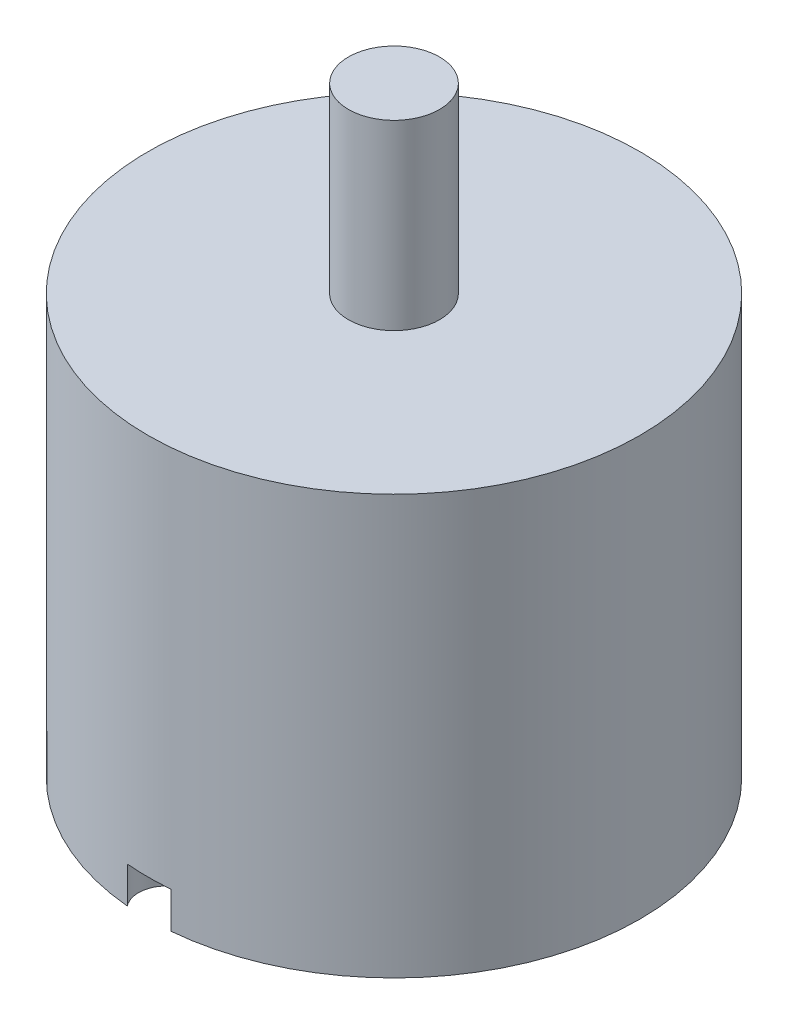
from build123d import *

# Parameters (mm, degrees)
SKETCH1_R           = 13.499973
BOSS_EXTRUDE1_DEPTH = 23.0000048
SKETCH2_R           = 2.5
BOSS_EXTRUDE2_DEPTH = 10
SKETCH3_R           = 1.626997
BOSS_EXTRUDE3_DEPTH = 2
SKETCH4_R           = 1.524
SKETCH4_R_2         = 1.5
CUT_EXTRUDE1_DEPTH  = 2


with BuildPart() as part:
    # Sketch1 → Boss-Extrude1 (new body)
    with BuildSketch(Plane(origin=(0, 0, 0), x_dir=(1, 0, 0), z_dir=(0, 1, 0))):
        Circle(SKETCH1_R)
    extrude(amount=BOSS_EXTRUDE1_DEPTH)

    # Sketch2 → Boss-Extrude2 (add)
    with BuildSketch(Plane(origin=(0, 23.0000048, 0), x_dir=(1, 0, 0), z_dir=(0, 1, 0))):
        Circle(SKETCH2_R)
    extrude(amount=BOSS_EXTRUDE2_DEPTH)

    # Sketch3 → Boss-Extrude3 (add)
    with BuildSketch(Plane.XZ):
        Circle(SKETCH3_R)
    extrude(amount=BOSS_EXTRUDE3_DEPTH)

    # Sketch4 → Cut-Extrude1 (cut)
    with BuildSketch(Plane.XZ):
        with Locations((0, 12.5000004)):
            Circle(SKETCH4_R)
        with Locations((9.4999937, 0)):
            Circle(SKETCH4_R_2)
        with Locations((-9.4999937, 0)):
            Circle(SKETCH4_R_2)
        with Locations((0, -12.5000004)):
            Circle(SKETCH4_R)
    extrude(amount=-CUT_EXTRUDE1_DEPTH, mode=Mode.SUBTRACT)


solid = part.part
